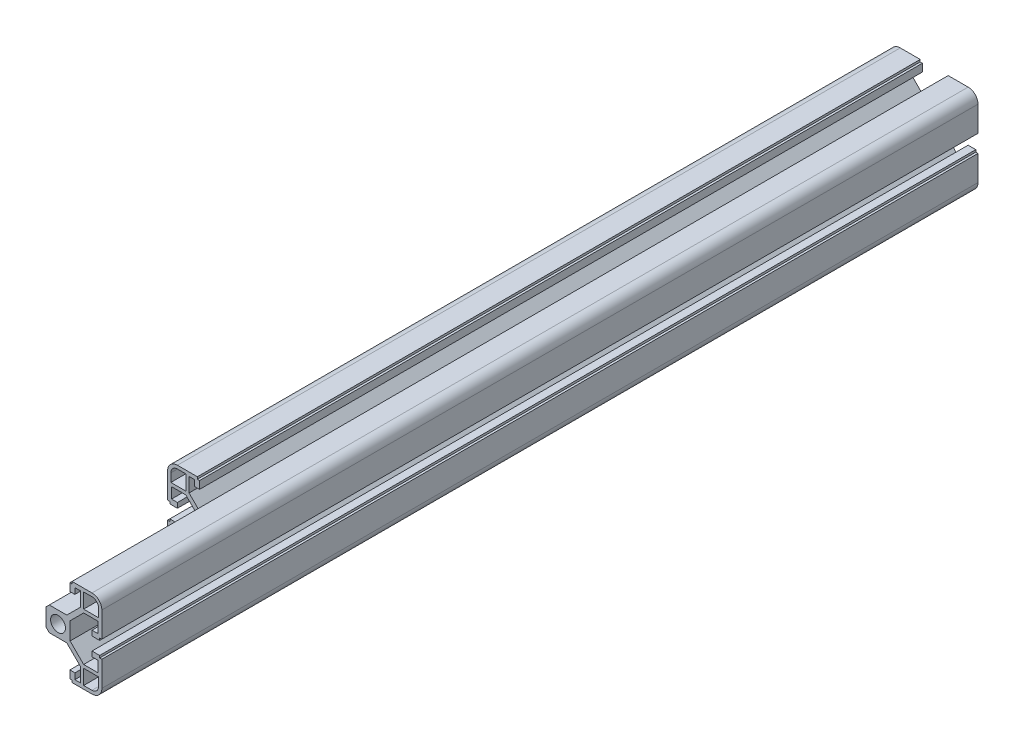
from build123d import *
from build123d.topology import SkipClean

# Parameters (mm, degrees)
BOSS_EXTRUDE1_DEPTH   = 400
MIRROR3_COPY_1_DEPTH  = 400
MIRROR3_COPY_2_DEPTH  = 400
CORTAR_EXTRUIR2_DEPTH = 70


with BuildPart() as part:
    # Sketch1 → Boss-Extrude1 (new body)
    with BuildSketch(Plane.XY):
        with BuildLine():
            Line((3.4, 0), (5.5, 0))
            Line((5.5, 0), (5.5, 4))
            Line((5.5, 4), (11.69, 10.19))
            Line((11.69, 10.19), (18.2, 10.19))
            Line((18.2, 10.19), (18.2, 5.265595036))
            Line((18.2, 5.265595036), (15.5, 5.265595036))
            Line((15.5, 5.265595036), (15.5, 2.965595036))
            Line((15.5, 2.965595036), (19, 2.965595036))
            Line((19, 2.965595036), (19, 3.965595036))
            Line((19, 3.965595036), (20, 3.965595036))
            Line((20, 3.965595036), (20, 15.5))
            ThreePointArc((20, 15.5), (18.681980515, 18.681980515), (15.5, 20))
            Line((15.5, 20), (6.385304712, 20))
            Line((6.385304712, 20), (6.385304712, 19))
            Line((6.385304712, 19), (5.385304712, 19))
            Line((5.385304712, 19), (5.385304712, 15.5))
            Line((5.385304712, 15.5), (7.685304712, 15.5))
            Line((7.685304712, 15.5), (7.685304712, 18.2))
            Line((7.685304712, 18.2), (10.19, 18.2))
            Line((10.19, 18.2), (10.19, 11.69))
            Line((10.19, 11.69), (4, 5.5))
            Line((4, 5.5), (0, 5.5))
            Line((0, 5.5), (0, 3.4))
            ThreePointArc((0, 3.4), (2.404163056, 2.404163056), (3.4, 0))
        make_face()
        with BuildLine():
            Line((18.5, 11.69), (18.5, 15.5))
            ThreePointArc((18.5, 15.5), (17.621320344, 17.621320344), (15.5, 18.5))
            Line((15.5, 18.5), (11.69, 18.5))
            Line((11.69, 18.5), (11.69, 11.69))
            Line((11.69, 11.69), (18.5, 11.69))
        make_face(mode=Mode.SUBTRACT)
    boss_extrude1 = extrude(amount=BOSS_EXTRUDE1_DEPTH)

    # Mirror1: Boss-Extrude1 across plane
    add(boss_extrude1.mirror(Plane.ZX))

    # Mirror2: Boss-Extrude1 across plane
    add(boss_extrude1.mirror(Plane(origin=(0, 0, 0), x_dir=(0, 0, 1), z_dir=(1, 0, 0))))

    # Mirror3 copy 1 sketch → Mirror3 copy 1 (add)
    with BuildSketch(Plane(origin=(0, 0, 0), x_dir=(-1, 0, 0), z_dir=(0, 0, 1))):
        with BuildLine():
            Line((3.4, 0), (5.5, 0))
            Line((5.5, 0), (5.5, 4))
            Line((5.5, 4), (11.69, 10.19))
            Line((11.69, 10.19), (18.2, 10.19))
            Line((18.2, 10.19), (18.2, 5.265595036))
            Line((18.2, 5.265595036), (15.5, 5.265595036))
            Line((15.5, 5.265595036), (15.5, 2.965595036))
            Line((15.5, 2.965595036), (19, 2.965595036))
            Line((19, 2.965595036), (19, 3.965595036))
            Line((19, 3.965595036), (20, 3.965595036))
            Line((20, 3.965595036), (20, 15.5))
            ThreePointArc((20, 15.5), (18.681980515, 18.681980515), (15.5, 20))
            Line((15.5, 20), (6.385304712, 20))
            Line((6.385304712, 20), (6.385304712, 19))
            Line((6.385304712, 19), (5.385304712, 19))
            Line((5.385304712, 19), (5.385304712, 15.5))
            Line((5.385304712, 15.5), (7.685304712, 15.5))
            Line((7.685304712, 15.5), (7.685304712, 18.2))
            Line((7.685304712, 18.2), (10.19, 18.2))
            Line((10.19, 18.2), (10.19, 11.69))
            Line((10.19, 11.69), (4, 5.5))
            Line((4, 5.5), (0, 5.5))
            Line((0, 5.5), (0, 3.4))
            ThreePointArc((0, 3.4), (2.404163056, 2.404163056), (3.4, 0))
        make_face()
        with BuildLine():
            Line((18.5, 11.69), (18.5, 15.5))
            ThreePointArc((18.5, 15.5), (17.621320344, 17.621320344), (15.5, 18.5))
            Line((15.5, 18.5), (11.69, 18.5))
            Line((11.69, 18.5), (11.69, 11.69))
            Line((11.69, 11.69), (18.5, 11.69))
        make_face(mode=Mode.SUBTRACT)
    extrude(amount=MIRROR3_COPY_1_DEPTH)

    # Mirror3 copy 2 sketch → Mirror3 copy 2 (add)
    with SkipClean():  # the faces are left unmerged after this step: merging them gives an invalid solid
        with BuildSketch(Plane.XY):
            with BuildLine():
                Line((3.4, 0), (5.5, 0))
                Line((5.5, 0), (5.5, -4))
                Line((5.5, -4), (11.69, -10.19))
                Line((11.69, -10.19), (18.2, -10.19))
                Line((18.2, -10.19), (18.2, -5.265595036))
                Line((18.2, -5.265595036), (15.5, -5.265595036))
                Line((15.5, -5.265595036), (15.5, -2.965595036))
                Line((15.5, -2.965595036), (19, -2.965595036))
                Line((19, -2.965595036), (19, -3.965595036))
                Line((19, -3.965595036), (20, -3.965595036))
                Line((20, -3.965595036), (20, -15.5))
                ThreePointArc((20, -15.5), (18.681980515, -18.681980515), (15.5, -20))
                Line((15.5, -20), (6.385304712, -20))
                Line((6.385304712, -20), (6.385304712, -19))
                Line((6.385304712, -19), (5.385304712, -19))
                Line((5.385304712, -19), (5.385304712, -15.5))
                Line((5.385304712, -15.5), (7.685304712, -15.5))
                Line((7.685304712, -15.5), (7.685304712, -18.2))
                Line((7.685304712, -18.2), (10.19, -18.2))
                Line((10.19, -18.2), (10.19, -11.69))
                Line((10.19, -11.69), (4, -5.5))
                Line((4, -5.5), (0, -5.5))
                Line((0, -5.5), (0, -3.4))
                ThreePointArc((0, -3.4), (2.404163056, -2.404163056), (3.4, 0))
            make_face()
            with BuildLine():
                Line((18.5, -11.69), (18.5, -15.5))
                ThreePointArc((18.5, -15.5), (17.621320344, -17.621320344), (15.5, -18.5))
                Line((15.5, -18.5), (11.69, -18.5))
                Line((11.69, -18.5), (11.69, -11.69))
                Line((11.69, -11.69), (18.5, -11.69))
            make_face(mode=Mode.SUBTRACT)
        extrude(amount=MIRROR3_COPY_2_DEPTH)

    # Croquis2 → Cortar-Extruir2 (cut)
    with SkipClean():  # the faces are left unmerged after this step: merging them gives an invalid solid
        with BuildSketch(Plane.XY.offset(400)):
            Polygon((-4, 5.5), (-5.5, 4), (-5.5, -4), (-4, -5.5), (-4, -28.376338008), (-28.376338008, -28.376338008), (-28.376338008, 30.826206059), (-4, 30.826206059), align=None)
        extrude(amount=-CORTAR_EXTRUIR2_DEPTH, mode=Mode.SUBTRACT)


solid = part.part
